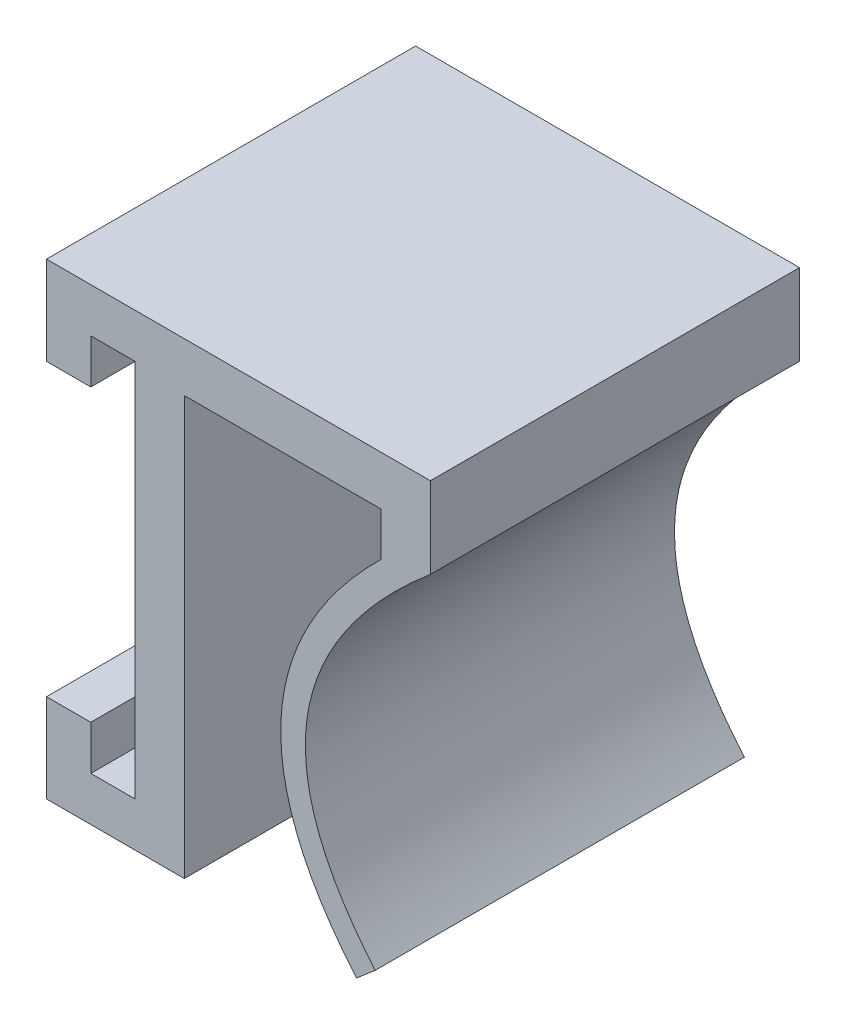
from build123d import *

# Parameters (mm, degrees)
AUFSATZ_LINEAR_AUSTRAGEN1_DEPTH = 15
SKIZZE8_W                       = 15
SKIZZE8_H                       = 1.8
AUFSATZ_LINEAR_AUSTRAGEN2_DEPTH = 3.6
SKIZZE9_W                       = 1.8
SKIZZE9_H                       = 15
AUFSATZ_LINEAR_AUSTRAGEN3_DEPTH = 1.8
SKIZZE10_W                      = 1.8
SKIZZE10_H                      = 15
AUFSATZ_LINEAR_AUSTRAGEN4_DEPTH = 1.8


# Read off the part's stored shape, not the designer's step: Aufsatz-Linear austragen1
with BuildPart() as part:
    # Aufsatz-Linear austragen1 outline → Aufsatz-Linear austragen1 (new body)
    with BuildSketch(Plane.XY):
        with BuildLine():
            Line((9, 7.5), (9, 5.734326374))
            add(Edge.make_bspline(
                [(9, 5.734326374), (1.374597046, -1.755638023), (8, -9.5)],
                knots=[0.105630562, 0.105630562, 0.105630562, 1, 1, 1], degree=2))
            Line((8, -9.5), (8.759868191, -8.849922825))
            add(Edge.make_bspline(
                [(11, 6.204093636), (10.807716783, 6.040836357), (10.227995606, 5.535038651), (9.02350357, 4.379363864), (7.631707894, 2.723931214), (6.526632736, 0.788286781), (5.948241105, -1.098227765), (5.864634496, -2.960727349), (6.26749431, -4.852517338), (7.040668693, -6.490456848), (7.923606451, -7.821764954), (8.477896684, -8.52033768), (8.759868191, -8.849922825)],
                knots=[0.032316638, 0.032316638, 0.032316638, 0.032316638, 0.0625, 0.125, 0.25, 0.375, 0.5, 0.625, 0.75, 0.875, 0.9375, 1, 1, 1, 1], degree=3))
            Line((11, 6.204093636), (11, 9.5))
            Line((11, 9.5), (-1, 9.5))
            Line((-1, 9.5), (-1, -9.5))
            Line((-1, -9.5), (1, -9.5))
            Line((1, -9.5), (1, 7.5))
            Line((1, 7.5), (9, 7.5))
        make_face()
    extrude(amount=AUFSATZ_LINEAR_AUSTRAGEN1_DEPTH)

    # Skizze8 → Aufsatz-Linear austragen2 (add)
    with BuildSketch(Plane.ZY.offset(1)):
        with Locations((7.5, 8.6)):
            Rectangle(SKIZZE8_W, SKIZZE8_H)
        with Locations((7.5, -8.6)):
            Rectangle(SKIZZE8_W, SKIZZE8_H)
    extrude(amount=AUFSATZ_LINEAR_AUSTRAGEN2_DEPTH)

    # Skizze9 → Aufsatz-Linear austragen3 (add)
    with BuildSketch(Plane(origin=(0, -7.7, 0), x_dir=(1, 0, 0), z_dir=(0, 1, 0))):
        with Locations((-3.7, -7.5)):
            Rectangle(SKIZZE9_W, SKIZZE9_H)
    extrude(amount=AUFSATZ_LINEAR_AUSTRAGEN3_DEPTH)

    # Skizze10 → Aufsatz-Linear austragen4 (add)
    with BuildSketch(Plane.XZ.offset(-7.7)):
        with Locations((-3.7, 7.5)):
            Rectangle(SKIZZE10_W, SKIZZE10_H)
    extrude(amount=AUFSATZ_LINEAR_AUSTRAGEN4_DEPTH)


solid = part.part
